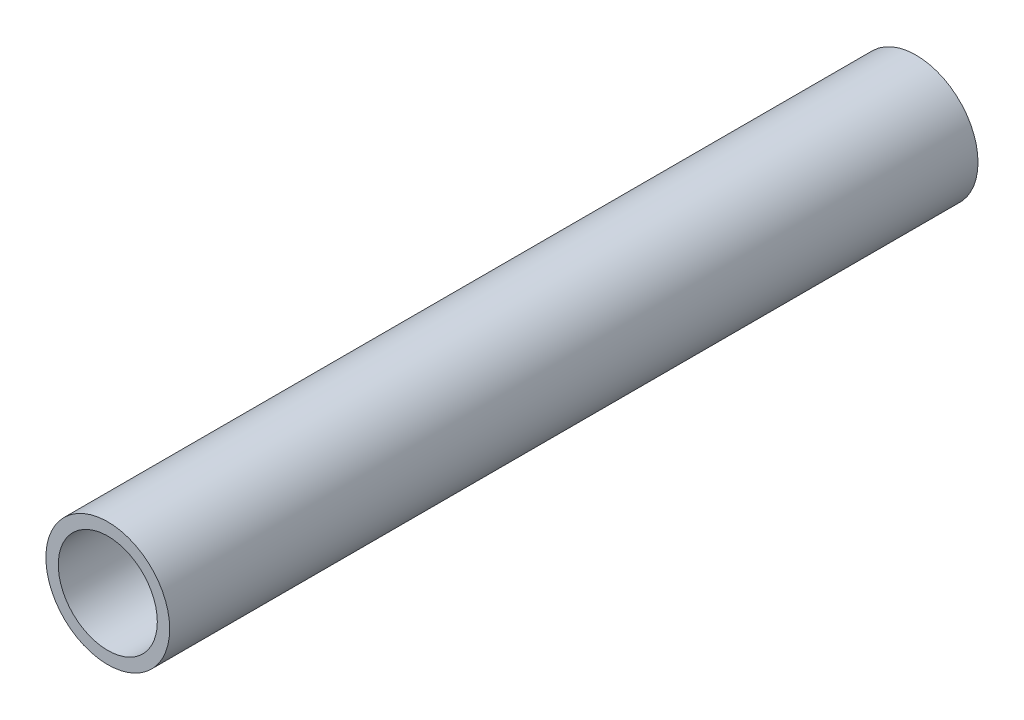
from build123d import *

# Parameters (mm, degrees)
SKETCH1_R           = 1.25
SKETCH1_R_2         = 1
BOSS_EXTRUDE1_DEPTH = 16.32


with BuildPart() as part:
    # Sketch1 → Boss-Extrude1 (new body)
    with BuildSketch(Plane.XY):
        Circle(SKETCH1_R)
        Circle(SKETCH1_R_2, mode=Mode.SUBTRACT)
    extrude(amount=BOSS_EXTRUDE1_DEPTH)


solid = part.part
